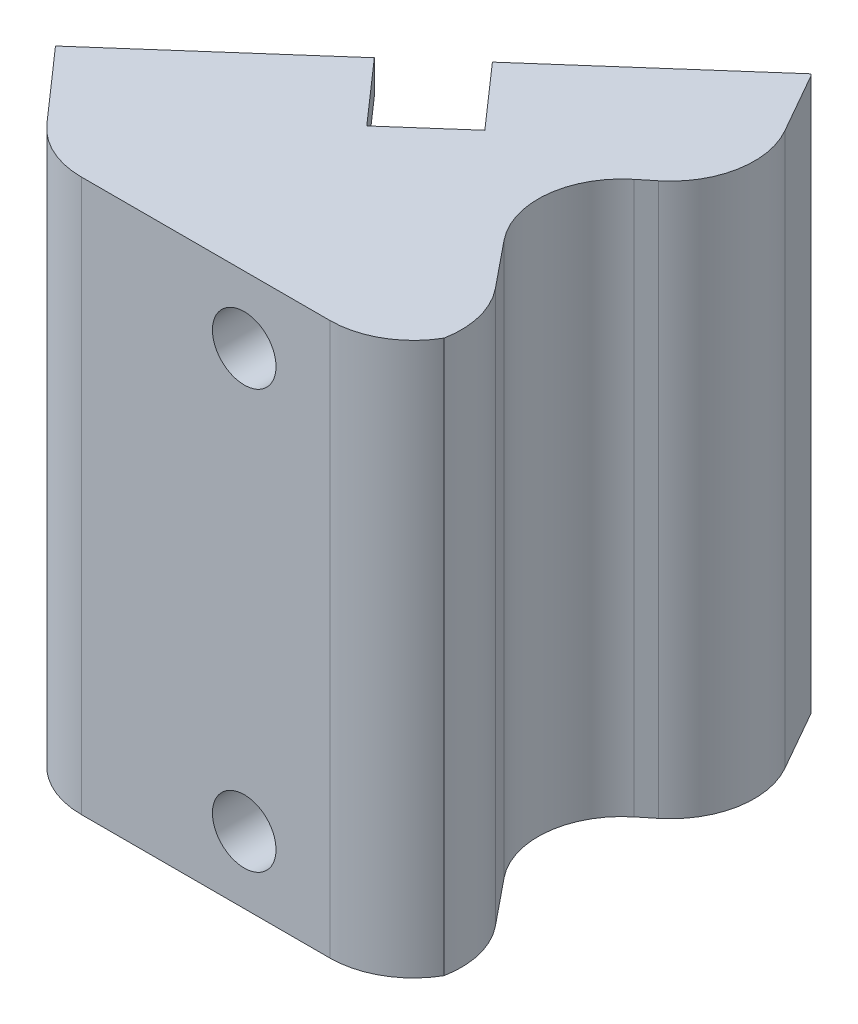
from build123d import *

# Parameters (mm, degrees)
BOSS_EXTRUDE1_DEPTH = 33
SKETCH2_W           = 32
SKETCH2_H           = 33
BOSS_EXTRUDE2_DEPTH = 3
SKETCH3_R           = 1.9
CUT_EXTRUDE1_DEPTH  = 7
FILLET1_R           = 5
SKETCH5_R           = 2
BOSS_EXTRUDE3_DEPTH = 5
SKETCH6_W           = 32
SKETCH6_H           = 33
SKETCH6_W_2         = 28
SKETCH6_H_2         = 29
BOSS_EXTRUDE4_DEPTH = 5
BOSS_EXTRUDE5_DEPTH = 5
SKETCH7_R           = 0.75
SKETCH7_W           = 5
SKETCH7_H           = 119.688008906
CUT_EXTRUDE3_DEPTH  = 5
CUT_EXTRUDE4_DEPTH  = 53.302482054
CUT_EXTRUDE5_DEPTH  = 51.632111281
FILLET4_R           = 5


with BuildPart() as part:
    # Sketch1 → Boss-Extrude1 (new body)
    with BuildSketch(Plane(origin=(0, 0, 0), x_dir=(1, 0, 0), z_dir=(0, 1, 0))):
        Polygon((0, 0), (20, 0), (30.159835274, 17.597350892), (24.022012397, 21.141024582), align=None)
    extrude(amount=BOSS_EXTRUDE1_DEPTH)

    # Sketch2 → Boss-Extrude2 (add)
    with BuildSketch(Plane(origin=(0, 0, 0), x_dir=(0.7506878874077226, 0, -0.660657018201828), z_dir=(0.660657018201828, 0, 0.7506878874077226))):
        with Locations((16, 16.5)):
            Rectangle(SKETCH2_W, SKETCH2_H)
    extrude(amount=-BOSS_EXTRUDE2_DEPTH)

    # Sketch3 → Cut-Extrude1 (cut)
    with BuildSketch(Plane(origin=(30, 0, 0), x_dir=(-1, 0, 0), z_dir=(0, 0, -1))):
        with Locations((18, 29)):
            Circle(SKETCH3_R)
        with Locations((18, 4)):
            Circle(SKETCH3_R)
    extrude(amount=CUT_EXTRUDE1_DEPTH, mode=Mode.SUBTRACT)

    # Fillet1
    fillet1_edges = [part.edges().sort_by_distance(p)[0] for p in [
        (20, 16.5, 0),
    ]]
    fillet(fillet1_edges, radius=FILLET1_R)

    # Sketch5 → Boss-Extrude3 (add)
    with BuildSketch(Plane(origin=(-1.981971055, 0, -2.252063662), x_dir=(-0.7506878874077226, 0, 0.660657018201828), z_dir=(-0.660657018201828, 0, -0.7506878874077226))):
        with Locations((-28.3, 28.4)):
            Circle(SKETCH5_R)
        with Locations((-3.7, 28.4)):
            Circle(SKETCH5_R)
        with Locations((-28.3, 4.6)):
            Circle(SKETCH5_R)
        with Locations((-3.7, 4.6)):
            Circle(SKETCH5_R)
    extrude(amount=BOSS_EXTRUDE3_DEPTH)

    # Sketch6 → Boss-Extrude4 (add)
    with BuildSketch(Plane(origin=(-1.981971055, 0, -2.252063662), x_dir=(-0.7506878874077226, 0, 0.660657018201828), z_dir=(-0.660657018201828, 0, -0.7506878874077226))):
        with Locations((-16, 16.5)):
            Rectangle(SKETCH6_W, SKETCH6_H)
        with Locations((-16, 16.5)):
            Rectangle(SKETCH6_W_2, SKETCH6_H_2, mode=Mode.SUBTRACT)
    extrude(amount=BOSS_EXTRUDE4_DEPTH)

    # Sketch9 → Boss-Extrude5 (add)
    with BuildSketch(Plane(origin=(-1.981971055, 0, -2.252063662), x_dir=(-0.7506878874077226, 0, 0.660657018201828), z_dir=(-0.660657018201828, 0, -0.7506878874077226))):
        Polygon((-28.3, 26.4), (-30, 26.4), (-30, 31), (-26.3, 31), (-26.3, 28.4), align=None)
        Polygon((-5.7, 28.4), (-5.7, 31), (-2, 31), (-2, 26.4), (-3.7, 26.4), align=None)
        Polygon((-3.7, 6.6), (-2, 6.6), (-2, 2), (-5.7, 2), (-5.7, 4.6), align=None)
        Polygon((-28.3, 6.6), (-30, 6.6), (-30, 2), (-26.3, 2), (-26.3, 4.6), align=None)
    extrude(amount=BOSS_EXTRUDE5_DEPTH)

    # Sketch7 → Cut-Extrude3 (cut)
    with BuildSketch(Plane(origin=(-5.285256146, 0, -6.005503099), x_dir=(-0.7506878874077226, 0, 0.660657018201828), z_dir=(-0.660657018201828, 0, -0.7506878874077226))):
        with Locations((-28.3, 28.4)):
            Circle(SKETCH7_R)
        with Locations((-3.7, 28.4)):
            Circle(SKETCH7_R)
        with Locations((-3.7, 4.6)):
            Circle(SKETCH7_R)
        with Locations((-28.3, 4.6)):
            Circle(SKETCH7_R)
        with Locations((-16, 31)):
            Rectangle(SKETCH7_W, SKETCH7_H)
    extrude(amount=-CUT_EXTRUDE3_DEPTH, mode=Mode.SUBTRACT)

    # Sketch8 → Cut-Extrude4 (cut, through all)
    with BuildSketch(Plane(origin=(0, 33, 0), x_dir=(1, 0, 0), z_dir=(0, 1, 0))):
        Polygon((17.745348673, 28.950001735), (16.878144986, 39.625600728), (45.212516216, 18.101512889), (33.036600924, 2.073102927), align=None)
    extrude(amount=-CUT_EXTRUDE4_DEPTH, mode=Mode.SUBTRACT)

    # Sketch10 → Cut-Extrude5 (cut, through all)
    with BuildSketch(Plane(origin=(0, 33, 0), x_dir=(1, 0, 0), z_dir=(0, 1, 0))):
        Polygon((22.997492955, 19.718491584), (15.018022413, 13.241165816), (22.396735909, 4.151268367), (32.809004156, 12.603414793), align=None)
    extrude(amount=-CUT_EXTRUDE5_DEPTH, mode=Mode.SUBTRACT)

    # Fillet4
    # the kernel refuses this fillet: 5 mm, written as the material it adds along each edge
    with BuildSketch(Plane(origin=(15.018022413, 33, -13.241165816), x_dir=(0.7763993545799179, 0, -0.6302412571451403), z_dir=(0, -1, 0))) as fillet4_piece_1:
        with BuildLine():
            CenterArc((FILLET4_R, FILLET4_R), FILLET4_R, 180, 90)
            Line((0, FILLET4_R), (0, 0))
            Line((0, 0), (FILLET4_R, 0))
        make_face()
    extrude(amount=33)
    # the kernel refuses this fillet: 5 mm, written as the material it takes off along each edge
    with BuildSketch(Plane(origin=(22.396735909, 40.861690342, -4.151268367), x_dir=(-0.6302412571451408, 0, -0.7763993545799174), z_dir=(0, -1, 0))) as fillet4_2_piece_1:
        with BuildLine():
            CenterArc((3.144676137, -5), FILLET4_R, 90, 49.922525522)
            Line((-0.681196741, -1.780885723), (0, 0))
            Line((0, 0), (3.144676137, 0))
        make_face()
    extrude(amount=48.723380684, mode=Mode.SUBTRACT)
    with BuildSketch(Plane(origin=(22.997492955, 43.594997798, -19.718491584), x_dir=(-0.4945052818029634, 0, -0.8691746235762823), z_dir=(0, -1, 0))) as fillet4_2_piece_2:
        with BuildLine():
            CenterArc((FILLET4_R * 0.847599823854, -FILLET4_R), FILLET4_R, 90, 80.569209056)
            Line((-FILLET4_R * 0.138884423377, -FILLET4_R * 0.836143874187), (0, 0))
            Line((0, 0), (FILLET4_R * 0.847599823854, 0))
        make_face()
    extrude(amount=54.189995596, mode=Mode.SUBTRACT)
    with BuildSketch(Plane(origin=(0, -5.650533789, 0), x_dir=(1, 0, 0), z_dir=(0, 1, 0))) as fillet4_2_piece_3:
        with BuildLine():
            CenterArc((FILLET4_R * 0.452042703087, FILLET4_R), FILLET4_R, 221.35, 48.65)
            Line((-FILLET4_R * 0.298645184321, FILLET4_R * 0.339342981798), (0, 0))
            Line((0, 0), (FILLET4_R * 0.452042703087, 0))
        make_face()
    extrude(amount=44.301067577, mode=Mode.SUBTRACT)


solid = part.part
